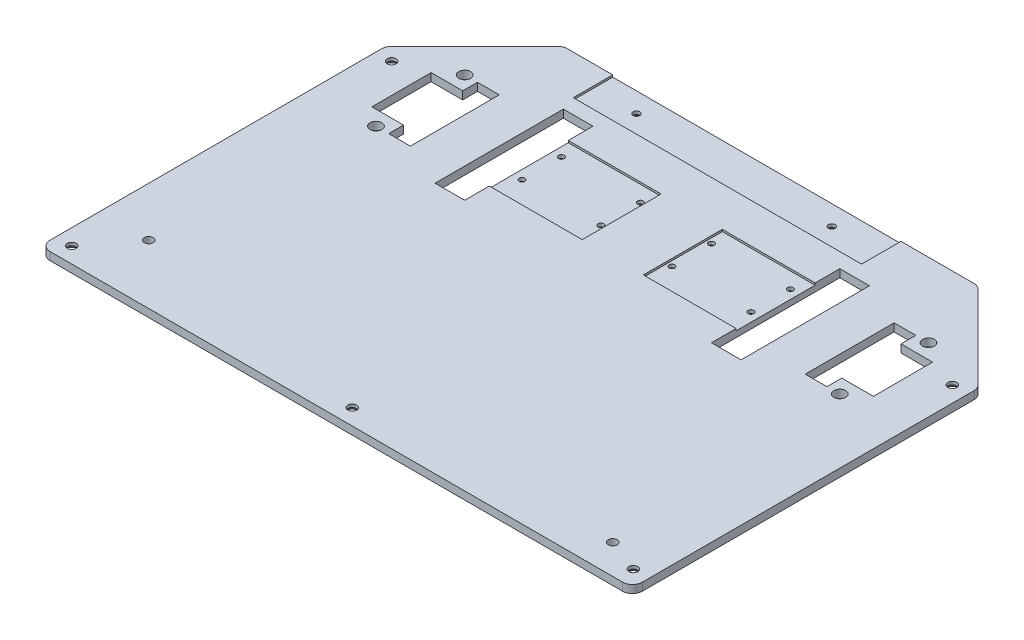
from build123d import *

# Parameters (mm, degrees)
MAIN_EXTRUSION_DEPTH                             = 4
CORNER_LEAVE_R                                   = 5
ESQUISSE2_R                                      = 3
ESQUISSE2_W                                      = 15
ESQUISSE2_H                                      = 65
ENL_V_MAT_EXTRU_1_DEPTH                          = 267.30058205
D_GAGEMENT_M41_D                                 = 4.5
ESQUISSE23_W                                     = 47
ESQUISSE23_H                                     = 40
ENL_V_MAT_EXTRU_2_DEPTH                          = 1
ESQUISSE24_R                                     = 1
ENL_V_MAT_EXTRU_3_DEPTH                          = 267.287438682
FRAISAGE_POUR_VIS_T_TE_FRAIS_E_M2_51_D           = 2.9
FRAISAGE_POUR_VIS_T_TE_FRAIS_E_M2_51_CSINK_D     = 5.5
FRAISAGE_POUR_VIS_T_TE_FRAIS_E_M2_51_CSINK_ANGLE = 90
FRAISAGE_POUR_VIS_T_TE_FRAIS_E_M41_AT_COUNT      = 2
FRAISAGE_POUR_VIS_T_TE_FRAIS_E_M41_AT_PITCH      = 142.035307944
FRAISAGE_POUR_VIS_T_TE_FRAIS_E_M41_2_COUNT       = 2
FRAISAGE_POUR_VIS_T_TE_FRAIS_E_M41_2_PITCH       = 284.035249862
FRAISAGE_POUR_VIS_T_TE_FRAIS_E_M41_3_COUNT       = 2
FRAISAGE_POUR_VIS_T_TE_FRAIS_E_M41_3_PITCH       = 326.770782266
FRAISAGE_POUR_VIS_T_TE_FRAIS_E_M41_4_COUNT       = 2
FRAISAGE_POUR_VIS_T_TE_FRAIS_E_M41_4_PITCH       = 161.565191978
ESQUISSE32_W                                     = 146
ESQUISSE32_H                                     = 20
ENL_V_MAT_EXTRU_4_DEPTH                          = 1
ESQUISSE33_R                                     = 1
ENL_V_MAT_EXTRU_5_DEPTH                          = 267.30058205
FRAISAGE_POUR_VIS_T_TE_FRAIS_E_M31_D             = 3.4
FRAISAGE_POUR_VIS_T_TE_FRAIS_E_M31_CSINK_D       = 6.3
FRAISAGE_POUR_VIS_T_TE_FRAIS_E_M31_CSINK_ANGLE   = 90


with BuildPart() as part:
    # Main scetch → Main extrusion (new body)
    with BuildSketch(Plane(origin=(0, 0, 0), x_dir=(1, 0, 0), z_dir=(0, 1, 0))):
        Polygon((-150, 0), (150, 0), (150, 175), (105, 220), (-105, 220), (-150, 175), align=None)
    extrude(amount=MAIN_EXTRUSION_DEPTH)

    # Corner leave
    corner_leave_edges = [part.edges().sort_by_distance(p)[0] for p in [
        (-150, 2, 0),
        (150, 2, -175),
        (105, 2, -220),
        (150, 2, 0),
        (-105, 2, -220),
        (-150, 2, -175),
    ]]
    fillet(corner_leave_edges, radius=CORNER_LEAVE_R)

    # Esquisse2 → Enlèv. mat.-Extru.1 (cut, through all)
    with BuildSketch(Plane(origin=(0, 4, 0), x_dir=(1, 0, 0), z_dir=(0, 1, 0))):
        with Locations((117.47, 182.47)):
            Circle(ESQUISSE2_R)
        with Locations((117.47, 137.53)):
            Circle(ESQUISSE2_R)
        with Locations((-117.47, 137.53)):
            Circle(ESQUISSE2_R)
        with Locations((-117.47, 182.47)):
            Circle(ESQUISSE2_R)
        with Locations((70, 160)):
            Rectangle(ESQUISSE2_W, ESQUISSE2_H)
        Polygon((100, 137.5), (100, 182.5), (111, 182.5), (111, 175), (127, 175), (127, 145), (111, 145), (111, 137.5), align=None)
        Polygon((-111, 137.5), (-111, 145), (-127, 145), (-127, 175), (-111, 175), (-111, 182.5), (-100, 182.5), (-100, 137.5), align=None)
        with Locations((-70, 160)):
            Rectangle(ESQUISSE2_W, ESQUISSE2_H)
    extrude(amount=-ENL_V_MAT_EXTRU_1_DEPTH, mode=Mode.SUBTRACT)

    # Dégagement M41 (through all)
    with Locations(Plane(origin=(0, 4, 0), x_dir=(1, 0, 0), z_dir=(0, 1, 0))):
        with Locations((-125, 30), (125, 15)):
            Hole(D_GAGEMENT_M41_D / 2)

    # Esquisse23 → Enlèv. mat.-Extru.2 (cut)
    with BuildSketch(Plane(origin=(0, 4, 0), x_dir=(1, 0, 0), z_dir=(0, 1, 0))):
        with Locations((-39, 160)):
            Rectangle(ESQUISSE23_W, ESQUISSE23_H)
    enl_v_mat_extru_2 = extrude(amount=-ENL_V_MAT_EXTRU_2_DEPTH, mode=Mode.SUBTRACT)

    # Esquisse24 → Enlèv. mat.-Extru.3 (cut, through all)
    with BuildSketch(Plane(origin=(0, 3, 0), x_dir=(1, 0, 0), z_dir=(0, 1, 0))):
        with Locations((-58, 172)):
            Circle(ESQUISSE24_R)
        with Locations((-58, 152)):
            Circle(ESQUISSE24_R)
        with Locations((-18, 172)):
            Circle(ESQUISSE24_R)
        with Locations((-18, 152)):
            Circle(ESQUISSE24_R)
    enl_v_mat_extru_3 = extrude(amount=-ENL_V_MAT_EXTRU_3_DEPTH, mode=Mode.SUBTRACT)

    # Fraisage pour vis à tête fraisée M2.51 (through all)
    with Locations(Plane(origin=(0, 0, 0), x_dir=(-1, 0, 0), z_dir=(0, -1, 0))):
        with Locations((18, 172), (58, 172), (58, 152), (18, 152)):
            fraisage_pour_vis_t_te_frais_e_m2_51 = CounterSinkHole(FRAISAGE_POUR_VIS_T_TE_FRAIS_E_M2_51_D / 2, FRAISAGE_POUR_VIS_T_TE_FRAIS_E_M2_51_CSINK_D / 2, counter_sink_angle=FRAISAGE_POUR_VIS_T_TE_FRAIS_E_M2_51_CSINK_ANGLE)

    # Symétrie1: Enlèv. mat.-Extru.2, Enlèv. mat.-Extru.3, Fraisage pour vis à tête fraisée M2.51 across plane
    add(enl_v_mat_extru_2.mirror(Plane(origin=(0, 0, 0), x_dir=(0, 0, 1), z_dir=(1, 0, 0))), mode=Mode.SUBTRACT)
    add(enl_v_mat_extru_3.mirror(Plane(origin=(0, 0, 0), x_dir=(0, 0, 1), z_dir=(1, 0, 0))), mode=Mode.SUBTRACT)
    add(fraisage_pour_vis_t_te_frais_e_m2_51.mirror(Plane(origin=(0, 0, 0), x_dir=(0, 0, 1), z_dir=(1, 0, 0))), mode=Mode.SUBTRACT)

    # Esquisse31 → Fraisage pour vis à tête fraisée M41 (revolve, cut)
    with BuildSketch(Plane(origin=(142.034917049, 0, -8.434811795), x_dir=(0, 0, -1), z_dir=(1, 0, 0))):
        Polygon((0, 0), (0, 4), (2.25, 4), (2.25, 2.45), (4.7, 0), align=None)
    fraisage_pour_vis_t_te_frais_e_m41 = revolve(axis=Axis((142.034917049, -6.35, -8.434811795), (0, 1, 0)), mode=Mode.SUBTRACT)

    # Fraisage pour vis à tête fraisée M41 at: Fraisage pour vis à tête fraisée M41 ×2
    with Locations(*[Vector(-0.9999972478981508, 0, 0.002346102326084912) * (i * FRAISAGE_POUR_VIS_T_TE_FRAIS_E_M41_AT_PITCH) for i in range(1, FRAISAGE_POUR_VIS_T_TE_FRAIS_E_M41_AT_COUNT)]):
        add(fraisage_pour_vis_t_te_frais_e_m41, mode=Mode.SUBTRACT)

    # Fraisage pour vis _ t_te frais_e M41 2: Fraisage pour vis à tête fraisée M41 ×2
    with Locations(*[Vector(-0.9999988282676796, 0, 0.0015308374400840067) * (i * FRAISAGE_POUR_VIS_T_TE_FRAIS_E_M41_2_PITCH) for i in range(1, FRAISAGE_POUR_VIS_T_TE_FRAIS_E_M41_2_COUNT)]):
        add(fraisage_pour_vis_t_te_frais_e_m41, mode=Mode.SUBTRACT)

    # Fraisage pour vis _ t_te frais_e M41 3: Fraisage pour vis à tête fraisée M41 ×2
    with Locations(*[Vector(-0.8692176059291576, 0, -0.4944297255857335) * (i * FRAISAGE_POUR_VIS_T_TE_FRAIS_E_M41_3_PITCH) for i in range(1, FRAISAGE_POUR_VIS_T_TE_FRAIS_E_M41_3_COUNT)]):
        add(fraisage_pour_vis_t_te_frais_e_m41, mode=Mode.SUBTRACT)

    # Fraisage pour vis _ t_te frais_e M41 4: Fraisage pour vis à tête fraisée M41 ×2
    with Locations(*[Vector(-0.00021611739763843655, 0, -0.999999976646635) * (i * FRAISAGE_POUR_VIS_T_TE_FRAIS_E_M41_4_PITCH) for i in range(1, FRAISAGE_POUR_VIS_T_TE_FRAIS_E_M41_4_COUNT)]):
        add(fraisage_pour_vis_t_te_frais_e_m41, mode=Mode.SUBTRACT)

    # Esquisse32 → Enlèv. mat.-Extru.4 (cut)
    with BuildSketch(Plane(origin=(0, 4, 0), x_dir=(1, 0, 0), z_dir=(0, 1, 0))):
        with Locations((-7, 210)):
            Rectangle(ESQUISSE32_W, ESQUISSE32_H)
    extrude(amount=-ENL_V_MAT_EXTRU_4_DEPTH, mode=Mode.SUBTRACT)

    # Esquisse33 → Enlèv. mat.-Extru.5 (cut, through all)
    with BuildSketch(Plane.XZ):
        with Locations((-58, -210)):
            Circle(ESQUISSE33_R)
        with Locations((41, -210)):
            Circle(ESQUISSE33_R)
    extrude(amount=-ENL_V_MAT_EXTRU_5_DEPTH, mode=Mode.SUBTRACT)

    # Fraisage pour vis à tête fraisée M31 (through all)
    with Locations(Plane(origin=(0, 0, 0), x_dir=(-1, 0, 0), z_dir=(0, -1, 0))):
        with Locations((58, 210), (-41, 210)):
            CounterSinkHole(FRAISAGE_POUR_VIS_T_TE_FRAIS_E_M31_D / 2, FRAISAGE_POUR_VIS_T_TE_FRAIS_E_M31_CSINK_D / 2, counter_sink_angle=FRAISAGE_POUR_VIS_T_TE_FRAIS_E_M31_CSINK_ANGLE)


solid = part.part
